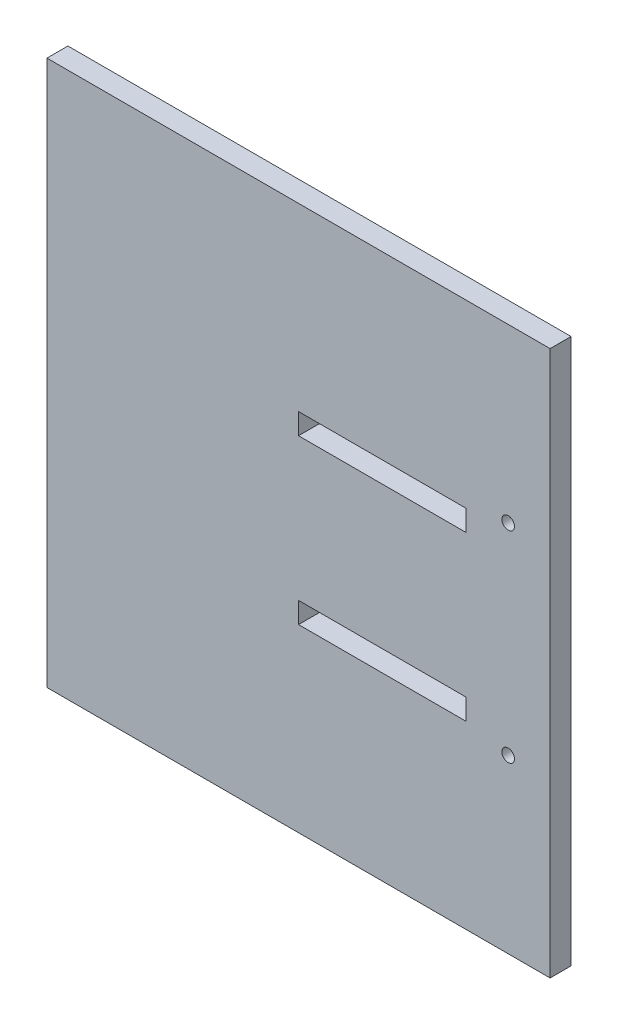
from build123d import *

# Parameters (mm, degrees)
SKETCH2_W           = 120
SKETCH2_H           = 130
BOSS_EXTRUDE1_DEPTH = 5
SKETCH3_R           = 1.5
SKETCH3_W           = 40
SKETCH3_H           = 5
CUT_EXTRUDE1_DEPTH  = 89.600225733


with BuildPart() as part:
    # Sketch2 → Boss-Extrude1 (new body)
    with BuildSketch(Plane.XY):
        Rectangle(SKETCH2_W, SKETCH2_H)
    extrude(amount=BOSS_EXTRUDE1_DEPTH)

    # Sketch3 → Cut-Extrude1 (cut, through all)
    with BuildSketch(Plane.XY):
        with Locations((50, 24)):
            Circle(SKETCH3_R)
        with Locations((50, -24)):
            Circle(SKETCH3_R)
        with Locations((20, 19.5)):
            Rectangle(SKETCH3_W, SKETCH3_H)
        with Locations((20, -19.5)):
            Rectangle(SKETCH3_W, SKETCH3_H)
    extrude(amount=CUT_EXTRUDE1_DEPTH, mode=Mode.SUBTRACT)


solid = part.part
